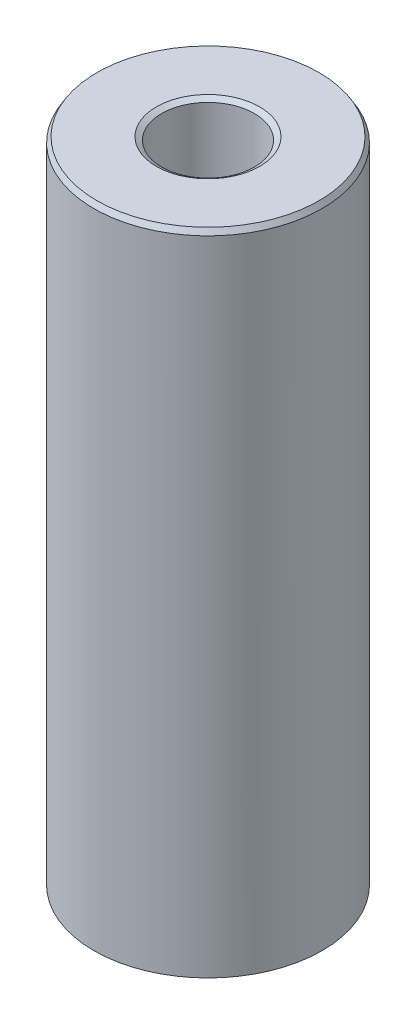
from build123d import *
from OCP.BRepFilletAPI import BRepFilletAPI_MakeChamfer

# Parameters (mm, degrees)
SKETCH1_R           = 52.5
BOSS_EXTRUDE1_DEPTH = 299.376387131
SKETCH2_R           = 21.335348492
CUT_EXTRUDE1_DEPTH  = 309.445653514
CHAMFER1_SIZE       = 2.411753142
CHAMFER1_SIZE2      = 1.443889796


with BuildPart() as part:
    # Sketch1 → Boss-Extrude1 (new body)
    with BuildSketch(Plane(origin=(0, 0, 0), x_dir=(1, 0, 0), z_dir=(0, 1, 0))):
        Circle(SKETCH1_R)
    extrude(amount=BOSS_EXTRUDE1_DEPTH)

    # Sketch2 → Cut-Extrude1 (cut, through all)
    with BuildSketch(Plane(origin=(0, 0, 0), x_dir=(1, 0, 0), z_dir=(0, 1, 0))):
        Circle(SKETCH2_R)
    extrude(amount=CUT_EXTRUDE1_DEPTH, mode=Mode.SUBTRACT)

    # Chamfer1: one chamfer whose edges measure the first distance from different faces: ONE call of the kernel's chamfer builder (chamfer() names one face for all edges)
    chamfer1_edges_1 = [part.edges().sort_by_distance(p)[0] for p in [
        (-21.335348492, 299.376387131, 0),
    ]]
    chamfer1_side_1 = [part.faces().sort_by_distance(p)[0] for p in [
        (-51.01507576, 299.376387131, 0),
    ]]
    chamfer1_edges_2 = [part.edges().sort_by_distance(p)[0] for p in [
        (-21.335348492, 0, 0),
    ]]
    chamfer1_side_2 = [part.faces().sort_by_distance(p)[0] for p in [
        (-21.335348492, 149.688193566, 0),
    ]]
    chamfer1_edges_3 = [part.edges().sort_by_distance(p)[0] for p in [
        (-52.5, 0, 0),
    ]]
    chamfer1_side_3 = [part.faces().sort_by_distance(p)[0] for p in [
        (-51.01507576, 0, 0),
    ]]
    chamfer1_edges_4 = [part.edges().sort_by_distance(p)[0] for p in [
        (-52.5, 299.376387131, 0),
    ]]
    chamfer1_side_4 = [part.faces().sort_by_distance(p)[0] for p in [
        (-52.5, 149.688193566, 0),
    ]]
    chamfer1 = BRepFilletAPI_MakeChamfer(part.part.solid().wrapped)
    for e in chamfer1_edges_1:
        chamfer1.Add(CHAMFER1_SIZE, CHAMFER1_SIZE2, e.wrapped, chamfer1_side_1[0].wrapped)  # the first distance lies on this face
    for e in chamfer1_edges_2:
        chamfer1.Add(CHAMFER1_SIZE, CHAMFER1_SIZE2, e.wrapped, chamfer1_side_2[0].wrapped)  # the first distance lies on this face
    for e in chamfer1_edges_3:
        chamfer1.Add(CHAMFER1_SIZE, CHAMFER1_SIZE2, e.wrapped, chamfer1_side_3[0].wrapped)  # the first distance lies on this face
    for e in chamfer1_edges_4:
        chamfer1.Add(CHAMFER1_SIZE, CHAMFER1_SIZE2, e.wrapped, chamfer1_side_4[0].wrapped)  # the first distance lies on this face
    add(Compound.cast(chamfer1.Shape()), mode=Mode.REPLACE)


solid = part.part
